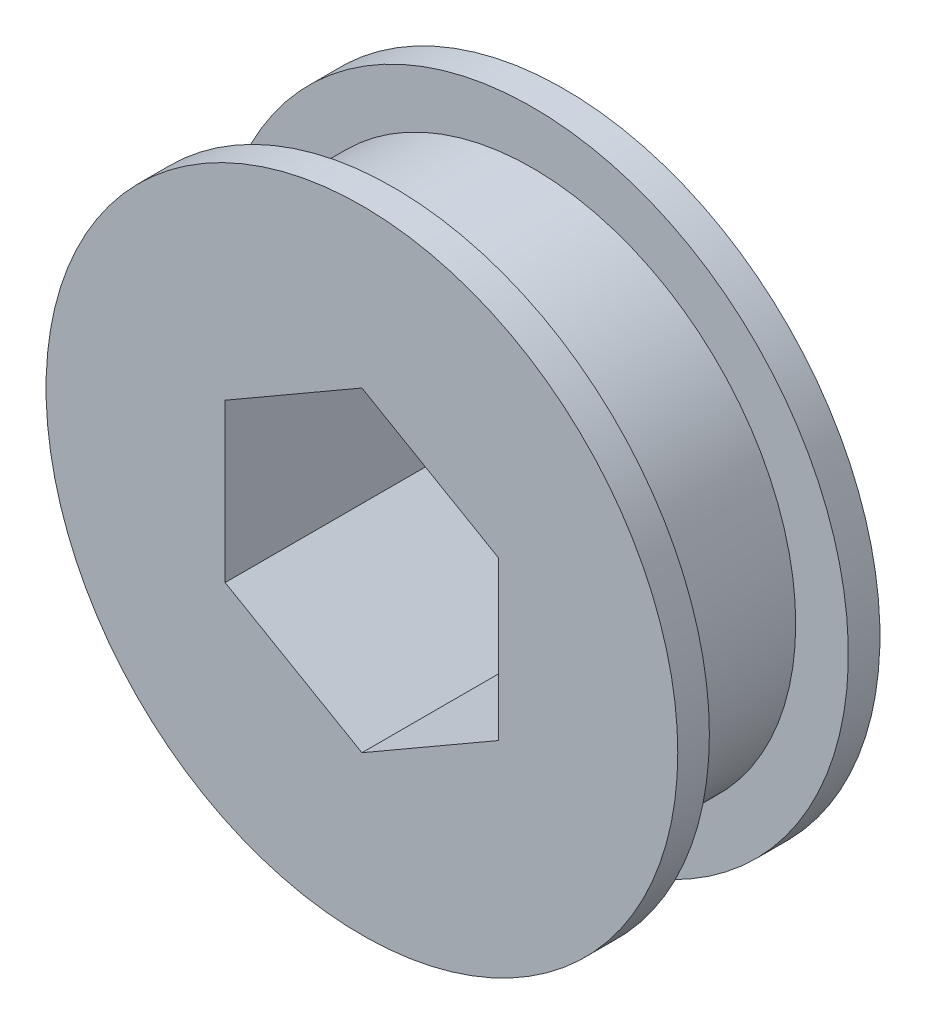
from build123d import *

# Parameters (mm, degrees)
SKETCH1_R               = 12.5
BOSS_EXTRUDE1_DEPTH     = 3.3
SKETCH2_R               = 15
BOSS_EXTRUDE2_DEPTH     = 1.5
BOSS_EXTRUDE3_START     = 1.5
SKETCH3_R               = 14.999999972
BOSS_EXTRUDE3_DEPTH     = 1.5
CUT_EXTRUDE1_DEPTH      = 24.284329494
CUT_EXTRUDE1_DEPTH_BACK = 24.284329494


with BuildPart() as part:
    # Sketch1 → Boss-Extrude1 (new, symmetric)
    with BuildSketch(Plane.XY):
        Circle(SKETCH1_R)
    extrude(amount=BOSS_EXTRUDE1_DEPTH, both=True)

    # Sketch2 → Boss-Extrude2 (add)
    with BuildSketch(Plane(origin=(0, 0, -3.3), x_dir=(-1, 0, 0), z_dir=(0, 0, -1))):
        Circle(SKETCH2_R)
    extrude(amount=BOSS_EXTRUDE2_DEPTH)

    # Sketch3 → Boss-Extrude3 (add)
    with BuildSketch(Plane.XY.offset(3.3).offset(BOSS_EXTRUDE3_START)):
        Circle(SKETCH3_R)
    extrude(amount=-BOSS_EXTRUDE3_DEPTH)

    # Sketch4 → Cut-Extrude1 (cut, two sides: drawn at the far end of the back side and taken through both)
    with BuildSketch(Plane.XY.offset(4.8).offset(-CUT_EXTRUDE1_DEPTH_BACK)):
        Polygon((0, 7.5), (-6.495190528, 3.75), (-6.495190528, -3.75), (0, -7.5), (6.495190528, -3.75), (6.495190528, 3.75), align=None)
    extrude(amount=CUT_EXTRUDE1_DEPTH + CUT_EXTRUDE1_DEPTH_BACK, mode=Mode.SUBTRACT)


solid = part.part
